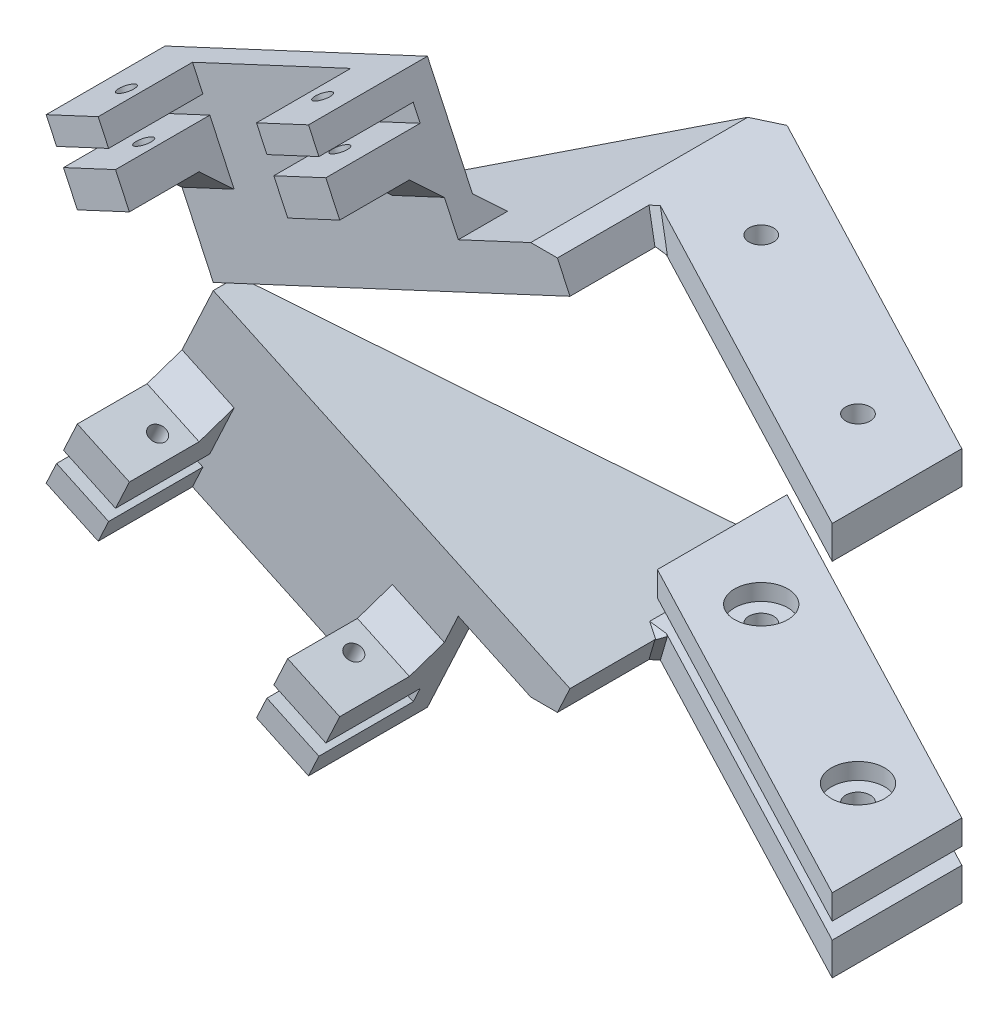
from build123d import *

# Parameters (mm, degrees)
BOSS_EXTRUDE1_DEPTH  = 3
SKETCH1_R            = 6
SKETCH1_R_2          = 5.999999999999998
BOSS_EXTRUDE3_DEPTH  = 2
SKETCH4_R            = 1.5000000000000013
SKETCH4_R_2          = 1.5000000000000009
CUT_EXTRUDE1_DEPTH   = 44.812962496801305
SKETCH5_R            = 3.25
SKETCH5_R_2          = 3.2500000000000004
CUT_EXTRUDE2_DEPTH   = 2
SKETCH6_R            = 1.5000000000000013
SKETCH6_R_2          = 1.5000000000000009
BOSS_EXTRUDE4_DEPTH  = 4
BOSS_EXTRUDE9_DEPTH  = 5
BOSS_EXTRUDE10_DEPTH = 3
BOSS_EXTRUDE11_DEPTH = 11.5
SKETCH24_R           = 0.9999999999999983
CUT_EXTRUDE3_DEPTH   = 71.05142175706676
CUT_EXTRUDE4_DEPTH   = 71.37296543116399
CUT_EXTRUDE5_DEPTH   = 75.00527115702536
CHAMFER2_SIZE        = 1
CHAMFER2_SIZE_2      = 0.849779112
CHAMFER2_SIZE_3      = 0.753042781
CHAMFER3_SIZE        = 48
CHAMFER3_SIZE_2      = 25
CHAMFER4_SIZE        = 3
CHAMFER5_SIZE        = 3


with BuildPart() as part:
    # Sketch3 → Boss-Extrude1 (new body)
    with BuildSketch(Plane(origin=(0, 0, 0), x_dir=(1, 0, 0), z_dir=(0, 1, 0))):
        Polygon((-10, 13.145588768291844), (-9.999999999999998, -2.66137686720019), (34.79919353527449, -26.14558876829183), (34.79919353527449, -10.33862313279981), align=None)
    extrude(amount=BOSS_EXTRUDE1_DEPTH)

    # Sketch1 → Boss-Extrude3 (add)
    with BuildSketch(Plane(origin=(0, 0, 0), x_dir=(1, 0, 0), z_dir=(0, 1, 0))):
        with Locations(Location((0, 0, 0), (0, 0, 270))):
            Circle(SKETCH1_R)
        with Locations(Location((24.79919353527449, -13.000000000000002, 0), (0, 0, 270))):
            Circle(SKETCH1_R_2)
    extrude(amount=-BOSS_EXTRUDE3_DEPTH)

    # Sketch4 → Cut-Extrude1 (cut, through all)
    with BuildSketch(Plane(origin=(0, 3, 0), x_dir=(1, 0, 0), z_dir=(0, 1, 0))):
        with Locations(Location((0, 0, 0), (0, 0, 270))):
            Circle(SKETCH4_R)
        with Locations(Location((24.79919353527449, -13.000000000000002, 0), (0, 0, 270))):
            Circle(SKETCH4_R_2)
    extrude(amount=-CUT_EXTRUDE1_DEPTH, mode=Mode.SUBTRACT)

    # Sketch5 → Cut-Extrude2 (cut)
    with BuildSketch(Plane(origin=(0, 3, 0), x_dir=(1, 0, 0), z_dir=(0, 1, 0))):
        with Locations(Location((0, 0, 0), (0, 0, 270))):
            Circle(SKETCH5_R)
        with Locations(Location((24.79919353527449, -13.000000000000002, 0), (0, 0, 270))):
            Circle(SKETCH5_R_2)
    extrude(amount=-CUT_EXTRUDE2_DEPTH, mode=Mode.SUBTRACT)


with BuildPart() as body_2:
    # Sketch6 → Boss-Extrude4 (new body)
    with BuildSketch(Plane.XZ.offset(2)):
        Polygon((-9.999999999999998, 2.66137686720019), (-10, -13.145588768291844), (34.79919353527449, 10.33862313279981), (34.79919353527449, 26.14558876829183), align=None)
        with Locations(Location((0, 0, 0), (0, 0, 270))):
            Circle(SKETCH6_R, mode=Mode.SUBTRACT)
        with Locations(Location((24.79919353527449, 13.000000000000002, 0), (0, 0, 270))):
            Circle(SKETCH6_R_2, mode=Mode.SUBTRACT)
    extrude(amount=BOSS_EXTRUDE4_DEPTH)

    # Sketch19 → Boss-Extrude9 (add)
    with BuildSketch(Plane(origin=(-2.5521063946862226, -5.473009825281398, 2.8e-16), x_dir=(0.9063077870366528, -0.42261826174069356, 0), z_dir=(0.42261826174069356, 0.9063077870366528, 0))):
        Polygon((-6.527368299922367, 13.145588768291844), (-6.5273682999223634, -14.854411231708156), (-54.52736829992237, -14.854411231708161), (-54.52736829992237, 13.145588768291844), align=None)
    extrude(amount=-BOSS_EXTRUDE9_DEPTH)

    # Sketch22 → Boss-Extrude10 (add)
    with BuildSketch(Plane.XY.offset(14.854411231708154)):
        Polygon((-51.9706848915214, 17.571251782926392), (-60.84566838807596, -1.4612117448433186), (-28.85300350568211, -16.379636384289785), (-19.97802000912756, 2.652827143479914), align=None)
    extrude(amount=-BOSS_EXTRUDE10_DEPTH)

    # Sketch23 → Boss-Extrude11 (add)
    with BuildSketch(Plane.XY.offset(14.854411231708154)):
        Polygon((-58.73257707937249, 3.0703271903399454), (-57.04210403240972, 6.695558338486558), (-50.697949523153156, 3.737230506301715), (-52.38842257011593, 0.11199935815509857), align=None)
        Polygon((-60.84566838807596, -1.4612117448433186), (-59.57781360285388, 1.2577116162666404), (-53.23365909359731, -1.7006162159182072), (-54.501513878819395, -4.419539577028165), align=None)
        Polygon((-35.19715801493865, -13.421308552104925), (-28.85300350568211, -16.379636384289785), (-27.58514872046003, -13.6607130231798), (-33.92930322971659, -10.702385190994963), align=None)
        Polygon((-33.0840667062352, -8.88976961692166), (-26.73991219697864, -11.8480974491065), (-25.049439150015868, -8.222866300959888), (-31.393593659272426, -5.264538468775042), align=None)
    extrude(amount=BOSS_EXTRUDE11_DEPTH)

    # Sketch24 → Cut-Extrude3 (cut, through all)
    with BuildSketch(Plane(origin=(-11.42708989124078, -24.505473353051112, 0), x_dir=(0.9063077870366529, -0.4226182617406931, 0), z_dir=(-0.42261826174069306, -0.9063077870366528, 0))):
        with Locations((-50.077368299922384, 20.604411231708156)):
            Circle(SKETCH24_R)
        with Locations((-23.677368299922374, 20.60441123170816)):
            Circle(SKETCH24_R)
    extrude(amount=-CUT_EXTRUDE3_DEPTH, mode=Mode.SUBTRACT)

    # Sketch25 → Cut-Extrude4 (cut, through all)
    with BuildSketch(Plane.XZ.offset(5.999999999999999)):
        Polygon((-1.7598045547698953, -8.82599101058171), (-0.856014781659975, -22.343448840083095), (-19.416391366852192, -22.343448840083095), (-12.561706832548245, 28.592130084052375), (-0.856014781659975, 28.592130084052375), align=None)
    extrude(amount=CUT_EXTRUDE4_DEPTH, mode=Mode.SUBTRACT)

    # Sketch26 → Cut-Extrude5 (cut, through all)
    with BuildSketch(Plane(origin=(3.2500000000000018, 0, -6.1997983838186235), x_dir=(-0.8856854834026603, 0, -0.46428571428571436), z_dir=(0.4642857142857144, 0, -0.8856854834026604))):
        Polygon((-2.6471574670381415, -3.4708885976233637), (-2.0453444794839015, -11.294457435868079), (36.03300455139902, -14.522363460038978), (23.996744800257375, 7.088193820427202), align=None)
    extrude(amount=CUT_EXTRUDE5_DEPTH, mode=Mode.SUBTRACT)

    # Chamfer2
    # the kernel refuses this chamfer: 1, 0.849779112, 0.753042781 mm, written as the material it adds along each edge
    with BuildSketch(Plane(origin=(-6.36268787947312, -3.696106496901656, 4.568094418300827), x_dir=(0.33809036708449836, 0.9242749779914556, 0.17723055251158967), z_dir=(-0.8186169306793458, 0.38172734387111207, -0.4291276683531757))) as chamfer2_piece_1_section:
        Polygon((CHAMFER2_SIZE, -2e-17), (CHAMFER2_SIZE_2 * 0.196215621581, -CHAMFER2_SIZE_2 * 0.980560773459), (0, 0), align=None)
    chamfer2_piece_1 = extrude(amount=7.014923756891123, mode=Mode.PRIVATE)
    chamfer2_piece_1 = split(chamfer2_piece_1, bisect_by=Plane(origin=(-6.36268787947312, -2, 4.568094418300827), z_dir=(0, -1, 0)), keep=Keep.TOP, mode=Mode.PRIVATE)
    chamfer2_piece_1 = split(chamfer2_piece_1, bisect_by=Plane(origin=(-8.46791111376206, -2.714424780626905, 4.568094418300827), z_dir=(-0.9063077870366527, 0.4226182617406935, 0)), keep=Keep.TOP, mode=Mode.PRIVATE)
    add(chamfer2_piece_1)
    with BuildSketch(Plane(origin=(-11.061112191786581, -8.275562438723423, 2.1051306137240746), x_dir=(-0.09141088767312612, -0.19603128122495278, 0.9763277044087783), z_dir=(0.4126139173265195, 0.884853401205295, 0.21629658712953703))) as chamfer2_piece_2_section:
        Polygon((CHAMFER2_SIZE, 0), (CHAMFER2_SIZE_3 * 0.420785758249, CHAMFER2_SIZE_3 * 0.907160044076), (0, 0), align=None)
    chamfer2_piece_2 = extrude(amount=8.85649542189165, mode=Mode.PRIVATE)
    chamfer2_piece_2 = split(chamfer2_piece_2, bisect_by=Plane(origin=(-11.061112191786581, -6, 2.1051306137240746), z_dir=(0, 1, 0)), keep=Keep.TOP, mode=Mode.PRIVATE)
    chamfer2_piece_2 = split(chamfer2_piece_2, bisect_by=Plane(origin=(-8.467911113762062, -2.7144247806268984, 2.105130613724074), z_dir=(-0.42261826174069356, -0.9063077870366528, 0)), keep=Keep.TOP, mode=Mode.PRIVATE)
    add(chamfer2_piece_2)
    with BuildSketch(Plane(origin=(-11.061112191786581, -8.275562438723423, 2.1051306137240746), x_dir=(-0.09141088767312612, -0.19603128122495278, 0.9763277044087783), z_dir=(0.4126139173265195, 0.884853401205295, 0.21629658712953703))) as chamfer2_piece_3a_section:
        Polygon((CHAMFER2_SIZE, 0), (CHAMFER2_SIZE_3 * 0.420785758249, CHAMFER2_SIZE_3 * 0.907160044076), (0, 0), align=None)
    chamfer2_piece_3a = extrude(amount=8.85649542189165, mode=Mode.PRIVATE)
    chamfer2_piece_3a = split(chamfer2_piece_3a, bisect_by=Plane(origin=(-11.061112191786581, -2, 2.1051306137240746), z_dir=(0, -1, 0)), keep=Keep.TOP, mode=Mode.PRIVATE)
    chamfer2_piece_3a = split(chamfer2_piece_3a, bisect_by=Plane(origin=(-8.467911113762062, -2.7144247806268993, 2.105130613724074), z_dir=(0.42261826174069356, 0.9063077870366528, 0)), keep=Keep.TOP, mode=Mode.PRIVATE)
    with BuildSketch(Plane(origin=(-6.36268787947312, -3.696106496901656, 4.568094418300827), x_dir=(0.33809036708449836, 0.9242749779914556, 0.17723055251158967), z_dir=(-0.8186169306793458, 0.38172734387111207, -0.4291276683531757))) as chamfer2_piece_3b_section:
        Polygon((CHAMFER2_SIZE, -2e-17), (CHAMFER2_SIZE_2 * 0.196215621581, -CHAMFER2_SIZE_2 * 0.980560773459), (0, 0), align=None)
    chamfer2_piece_3b = extrude(amount=7.014923756891123, mode=Mode.PRIVATE)
    chamfer2_piece_3b = split(chamfer2_piece_3b, bisect_by=Plane(origin=(-6.36268787947312, -2, 4.568094418300827), z_dir=(0, -1, 0)), keep=Keep.TOP, mode=Mode.PRIVATE)
    chamfer2_piece_3b = split(chamfer2_piece_3b, bisect_by=Plane(origin=(-8.46791111376206, -2.714424780626905, 4.568094418300827), z_dir=(0.9063077870366527, -0.4226182617406935, 0)), keep=Keep.TOP, mode=Mode.PRIVATE)
    chamfer2_piece_3 = chamfer2_piece_3a & chamfer2_piece_3b
    add(chamfer2_piece_3)

    # Chamfer3
    # the kernel refuses this chamfer: 48, 25 mm, written as the material it takes off along each edge
    with BuildSketch(Plane(origin=(0.5510317235878048, 130.20443654107186, -13.145588768291852), x_dir=(0.9063077870366527, -0.4226182617406935, 0), z_dir=(-0.4226182617406935, -0.9063077870366527, 0))) as chamfer3_piece_1:
        Polygon((CHAMFER3_SIZE, 0), (7.36e-15, CHAMFER3_SIZE_2), (0, 0), align=None)
    extrude(amount=253.55393800912003, mode=Mode.SUBTRACT)

    # Chamfer4
    chamfer4_edges = [body_2.edges().sort_by_distance(p)[0] for p in [
        (-38.08744375902795, 5.580500528019885, 11.854411231708156),
    ]]
    chamfer(chamfer4_edges, length=CHAMFER4_SIZE)

    # Chamfer5
    chamfer5_edges = [body_2.edges().sort_by_distance(p)[0] for p in [
        (-53.87002677778143, 5.216394422394137, 14.854411231708154),
        (-28.22151640464415, -6.743702384867465, 14.854411231708154),
    ]]
    chamfer(chamfer5_edges, length=CHAMFER5_SIZE)


with BuildPart() as body_3:
    # Mirror1: mirrored copy
    add(body_2.part.mirror(Plane.ZX.offset(18.000000000000004)))


solid = Compound([part.part, body_2.part, body_3.part])
